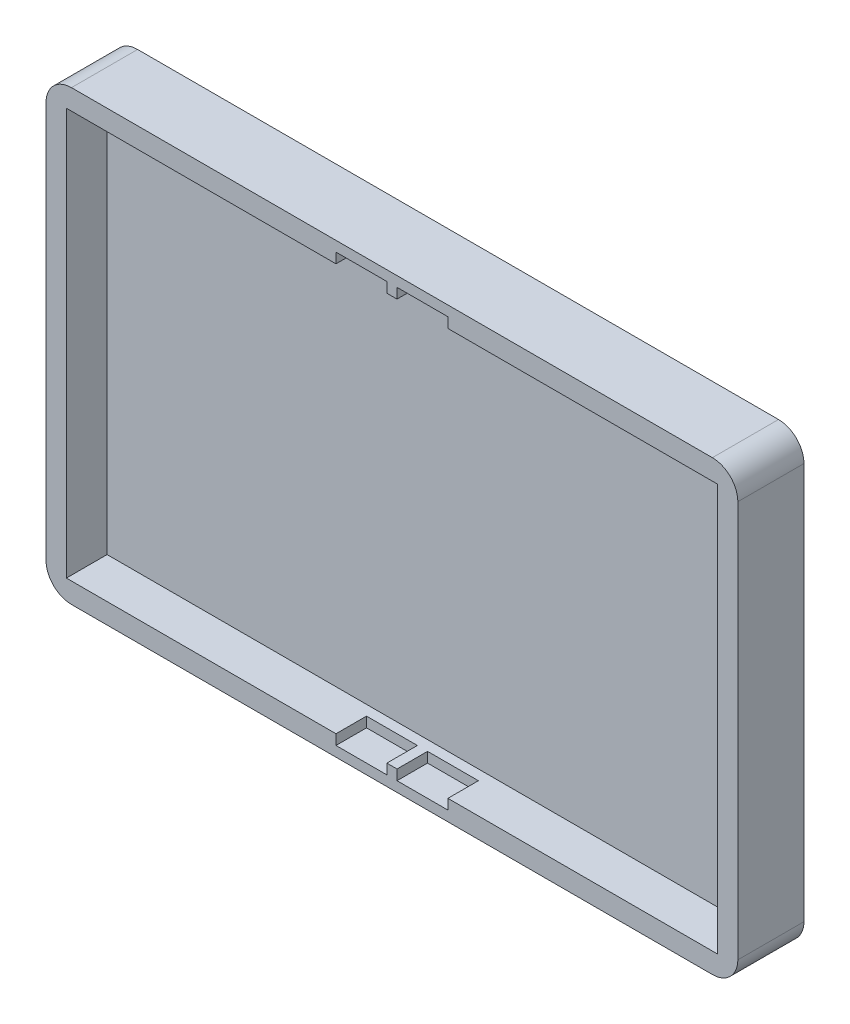
from build123d import *

# Parameters (mm, degrees)
SKETCH1_W               = 68
SKETCH1_H               = 44
BOSS_EXTRUDE1_DEPTH     = 6.5
SKETCH2_W               = 64
SKETCH2_H               = 40
CUT_EXTRUDE1_DEPTH      = 4
CUT_EXTRUDE2_DEPTH      = 41
CUT_EXTRUDE2_DEPTH_BACK = 1
SKETCH4_W               = 5
SKETCH4_H               = 2
CORNER_FILLET_R         = 2.5
SKETCH5_W               = 5
SKETCH5_H               = 1
CUT_EXTRUDE3_DEPTH      = 1
SKETCH6_W               = 5
SKETCH6_H               = 1
CUT_EXTRUDE4_DEPTH      = 1
SKETCH7_W               = 5
SKETCH7_H               = 1
CUT_EXTRUDE5_DEPTH      = 1
SKETCH8_W               = 5
SKETCH8_H               = 1
CUT_EXTRUDE6_DEPTH      = 1


with BuildPart() as part:
    # Sketch1 → Boss-Extrude1 (new body)
    with BuildSketch(Plane.XY):
        with Locations((34, 22)):
            Rectangle(SKETCH1_W, SKETCH1_H)
    extrude(amount=BOSS_EXTRUDE1_DEPTH)

    # Sketch2 → Cut-Extrude1 (cut)
    with BuildSketch(Plane.XY.offset(6.5)):
        with Locations((34, 22)):
            Rectangle(SKETCH2_W, SKETCH2_H)
    extrude(amount=-CUT_EXTRUDE1_DEPTH, mode=Mode.SUBTRACT)

    # Sketch4 → Cut-Extrude2 (cut, two sides: drawn at the far end of the back side and taken through both)
    with BuildSketch(Plane.XZ.offset(-42).offset(-CUT_EXTRUDE2_DEPTH_BACK)):
        with Locations((31, 4.5)):
            Rectangle(SKETCH4_W, SKETCH4_H)
        with Locations((37, 4.5)):
            Rectangle(SKETCH4_W, SKETCH4_H)
    extrude(amount=CUT_EXTRUDE2_DEPTH + CUT_EXTRUDE2_DEPTH_BACK, mode=Mode.SUBTRACT)

    # Corner Fillet
    corner_fillet_edges = [part.edges().sort_by_distance(p)[0] for p in [
        (0, 44, 3.25),
        (0, 0, 3.25),
        (68, 0, 3.25),
        (68, 44, 3.25),
    ]]
    fillet(corner_fillet_edges, radius=CORNER_FILLET_R)

    # Sketch5 → Cut-Extrude3 (cut)
    with BuildSketch(Plane(origin=(0, 2, 0), x_dir=(1, 0, 0), z_dir=(0, 1, 0))):
        with Locations((31, -6)):
            Rectangle(SKETCH5_W, SKETCH5_H)
    extrude(amount=-CUT_EXTRUDE3_DEPTH, mode=Mode.SUBTRACT)

    # Sketch6 → Cut-Extrude4 (cut)
    with BuildSketch(Plane.XZ.offset(-42)):
        with Locations((37, 6)):
            Rectangle(SKETCH6_W, SKETCH6_H)
    extrude(amount=-CUT_EXTRUDE4_DEPTH, mode=Mode.SUBTRACT)

    # Sketch7 → Cut-Extrude5 (cut)
    with BuildSketch(Plane(origin=(0, 2, 0), x_dir=(1, 0, 0), z_dir=(0, 1, 0))):
        with Locations((37, -6)):
            Rectangle(SKETCH7_W, SKETCH7_H)
    extrude(amount=-CUT_EXTRUDE5_DEPTH, mode=Mode.SUBTRACT)

    # Sketch8 → Cut-Extrude6 (cut)
    with BuildSketch(Plane.XZ.offset(-42)):
        with Locations((31, 6)):
            Rectangle(SKETCH8_W, SKETCH8_H)
    extrude(amount=-CUT_EXTRUDE6_DEPTH, mode=Mode.SUBTRACT)


solid = part.part
